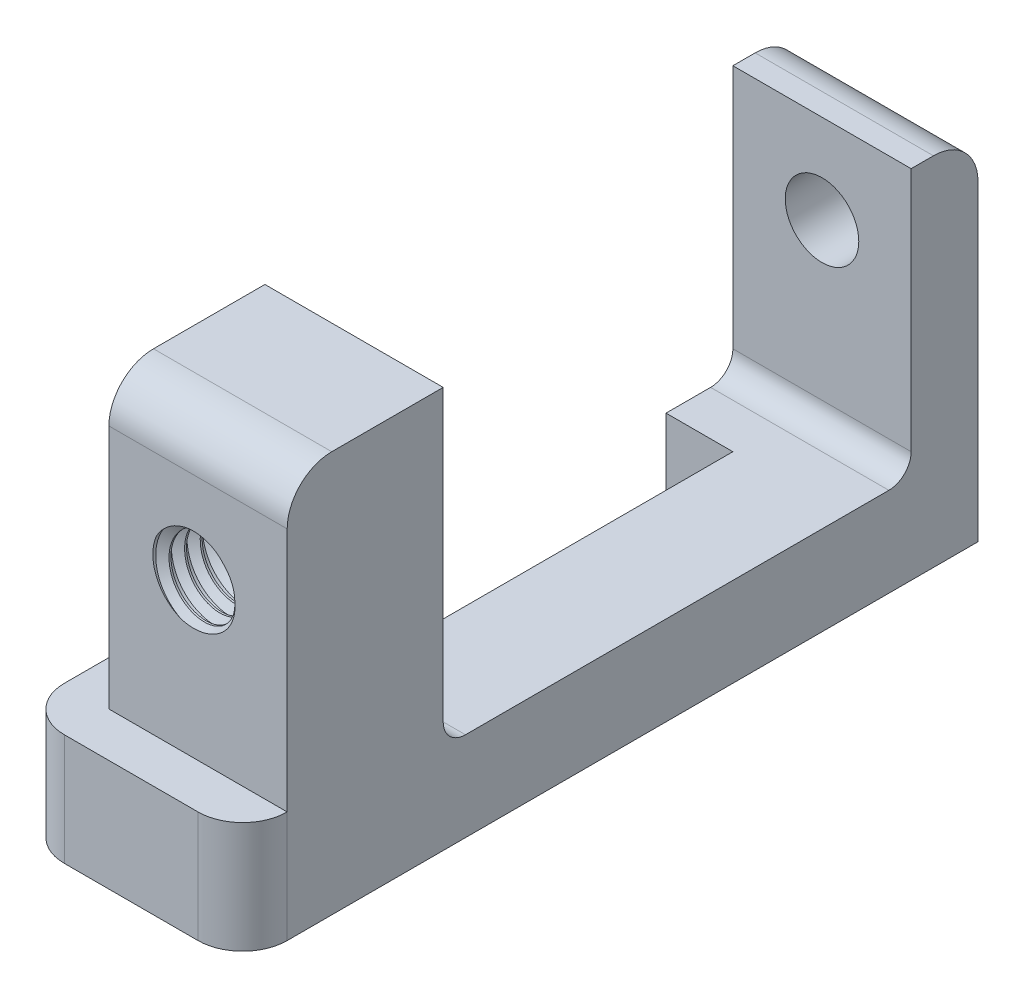
from build123d import *

# Parameters (mm, degrees)
BOSS_EXTRUDE1_DEPTH             = 8
CUT_EXTRUDE2_DEPTH              = 21
BOSS_EXTRUDE2_DEPTH             = 3
BOSS_EXTRUDE5_DEPTH             = 5
SKETCH6_R                       = 1.65
CUT_EXTRUDE3_DEPTH              = 38.215588132
FILLET1_R                       = 2
THREAD1_PITCH                   = 0.7
THREAD3_PITCH                   = 0.5
FILLET2_R                       = 1
TAP_DRILL_FOR_M3X0_5_TAP1_D     = 2.5
TAP_DRILL_FOR_M3X0_5_TAP1_DEPTH = 3
TAP_DRILL_FOR_M3X0_5_TAP1_TIP   = 0.751075774
THREAD4_PITCH                   = 0.5


# Read off the part's stored shape, not the designer's step: Tap Drill for M3x0.5 Tap
with BuildPart() as part:
    # Sketch1 → Boss-Extrude1 (new body)
    with BuildSketch(Plane(origin=(0, 0, 0), x_dir=(0, 0, -1), z_dir=(1, 0, 0))):
        Polygon((0, 0), (0, 16), (-3, 16), (-3, 4), (-24, 4), (-24, 18), (-31, 18), (-31, 0), align=None)
    extrude(amount=-BOSS_EXTRUDE1_DEPTH)

    # Sketch5 → Cut-Extrude2 (cut)
    with BuildSketch(Plane.XY.offset(3)):
        Polygon((-8, 0), (-3, 0), (-5, 4), (-8, 4), align=None)
    extrude(amount=CUT_EXTRUDE2_DEPTH, mode=Mode.SUBTRACT)

    # Sketch8 → Boss-Extrude2 (add)
    with BuildSketch(Plane.XY.offset(3)):
        Polygon((-8, 4), (-5, 4), (-3, 0), (-8, 0), align=None)
    extrude(amount=BOSS_EXTRUDE2_DEPTH)

    # Sketch11 → Boss-Extrude5 (add)
    with BuildSketch(Plane.XZ):
        with BuildLine():
            Line((-10, 26), (-10, 33))
            Line((-10, 33), (-2, 33))
            ThreePointArc((-2, 33), (-0.585786438, 32.414213562), (0, 31))
            Line((0, 31), (-8, 31))
            Line((-8, 31), (-8, 24))
            ThreePointArc((-8, 24), (-9.414213562, 24.585786438), (-10, 26))
        make_face()
    extrude(amount=-BOSS_EXTRUDE5_DEPTH)

    # Sketch6 → Cut-Extrude3 (cut, through all)
    with BuildSketch(Plane.XY.offset(31)):
        with Locations((-4, 12)):
            Circle(SKETCH6_R)
    extrude(amount=-CUT_EXTRUDE3_DEPTH, mode=Mode.SUBTRACT)

    # Fillet1
    fillet1_edges = [part.edges().sort_by_distance(p)[0] for p in [
        (-4, 18, 31),
        (-4, 16, 0),
        (-10, 2.5, 33),
    ]]
    fillet(fillet1_edges, radius=FILLET1_R)

    # Tap Drill for M3x0.5 Tap outline → Tap Drill for M3x0.5 Tap (revolve, cut)
    with BuildSketch(Plane(origin=(-4.1, 0, 3), x_dir=(1, 0, 0), z_dir=(0, 0, 1))):
        Polygon((1.25, 3), (0, 3.751075774), (0, 0), (1.25, 0), align=None)
    revolve(axis=Axis((-4.1, 0, 3), (0, 1, 0)), mode=Mode.SUBTRACT)

    # Thread1: the profile of Thread Profile1 profile screwed along a right-hand helix of 10 turns, 6 arcs to a turn; built about Z, then put on its axis
    thread1_z = Axis((0, 0, 0), (0, 0, 1))
    thread1_corners = [(1.6497, 0, 0.612673207), (1.6497, 0, -0.000173205), (2.028886116, 0, 0.218750001), (2.028886116, 0, 0.393750001)]
    with BuildLine(mode=Mode.PRIVATE) as thread1_profile:
        Line(thread1_corners[0], thread1_corners[1])
        Line(thread1_corners[1], thread1_corners[2])
        Line(thread1_corners[2], thread1_corners[3])
        Line(thread1_corners[3], thread1_corners[0])
    thread1_cap = Face(thread1_profile.wire())
    thread1_turn_angles = [0, 30, 60, 90, 120, 150, 180, 210, 240, 270, 300, 330, 360]
    thread1_turn_weights = [1, 0.8660254037844387, 1, 0.8660254037844387, 1, 0.8660254037844387, 1, 0.8660254037844387, 1, 0.8660254037844387, 1, 0.8660254037844387, 1]
    thread1_turn_rails = [Edge.make_bspline([Vector(p[0], p[1], 0).rotate(thread1_z, thread1_turn_angles[k]) / thread1_turn_weights[k] + Vector(0, 0, p[2] + THREAD1_PITCH * thread1_turn_angles[k] / 360) for k in range(13)], [0, 0, 0, 1, 1, 2, 2, 3, 3, 4, 4, 5, 5, 6, 6, 6], 2, thread1_turn_weights) for p in thread1_corners]
    thread1_turn_sides = [Face.make_surface_from_curves(thread1_turn_rails[p[0]], thread1_turn_rails[p[1]]) for p in [(0, 1), (1, 2), (2, 3), (3, 0)]]
    thread1 = Plane(origin=(-4, 12, 24), x_dir=(1, 0, 0), z_dir=(0, 0, 1)) * Solid(Shell([*[p.moved(Location((0, 0, THREAD1_PITCH * i))) for i in range(10) for p in thread1_turn_sides], thread1_cap, thread1_cap.rotate(thread1_z, 3600).moved(Location((0, 0, THREAD1_PITCH * 3600 / 360)))]))
    add(thread1, mode=Mode.SUBTRACT)

    # Thread3: the profile of Thread Profile3 profile screwed along a right-hand helix of 6 turns, 6 arcs to a turn; built about Z, then put on its axis
    thread3_z = Axis((0, 0, 0), (0, 0, 1))
    thread3_corners = [(1.2497, 0, -0.000173205), (1.520632938, 0, 0.156249999), (1.520632938, 0, 0.218749999), (1.2497, 0, 0.375173204)]
    with BuildLine(mode=Mode.PRIVATE) as thread3_profile:
        Line(thread3_corners[0], thread3_corners[1])
        Line(thread3_corners[1], thread3_corners[2])
        Line(thread3_corners[2], thread3_corners[3])
        Line(thread3_corners[3], thread3_corners[0])
    thread3_cap = Face(thread3_profile.wire())
    thread3_turn_angles = [0, 30, 60, 90, 120, 150, 180, 210, 240, 270, 300, 330, 360]
    thread3_turn_weights = [1, 0.8660254037844387, 1, 0.8660254037844387, 1, 0.8660254037844387, 1, 0.8660254037844387, 1, 0.8660254037844387, 1, 0.8660254037844387, 1]
    thread3_turn_rails = [Edge.make_bspline([Vector(p[0], p[1], 0).rotate(thread3_z, thread3_turn_angles[k]) / thread3_turn_weights[k] + Vector(0, 0, p[2] + THREAD3_PITCH * thread3_turn_angles[k] / 360) for k in range(13)], [0, 0, 0, 1, 1, 2, 2, 3, 3, 4, 4, 5, 5, 6, 6, 6], 2, thread3_turn_weights) for p in thread3_corners]
    thread3_turn_sides = [Face.make_surface_from_curves(thread3_turn_rails[p[0]], thread3_turn_rails[p[1]]) for p in [(0, 1), (1, 2), (2, 3), (3, 0)]]
    thread3 = Plane(origin=(-4.1, 0, 3), x_dir=(1, 0, 0), z_dir=(0, 1, 0)) * Solid(Shell([*[p.moved(Location((0, 0, THREAD3_PITCH * i))) for i in range(6) for p in thread3_turn_sides], thread3_cap, thread3_cap.rotate(thread3_z, 2160).moved(Location((0, 0, THREAD3_PITCH * 2160 / 360)))]))
    add(thread3, mode=Mode.SUBTRACT)

    # Fillet2
    fillet2_edges = [part.edges().sort_by_distance(p)[0] for p in [
        (-4, 4, 3),
        (-2.5, 4, 24),
    ]]
    fillet(fillet2_edges, radius=FILLET2_R)

    # Tap Drill for M3x0.5 Tap1
    with Locations(Plane(origin=(-5.72, 0, 29), x_dir=(0, 0, -1), z_dir=(0, -1, 0))):
        with Locations((0, 0)):
            Hole(TAP_DRILL_FOR_M3X0_5_TAP1_D / 2, depth=TAP_DRILL_FOR_M3X0_5_TAP1_DEPTH)
            with Locations((0, 0, -(TAP_DRILL_FOR_M3X0_5_TAP1_DEPTH + TAP_DRILL_FOR_M3X0_5_TAP1_TIP / 2))):  # 118° drill point
                Cone(0, TAP_DRILL_FOR_M3X0_5_TAP1_D / 2, TAP_DRILL_FOR_M3X0_5_TAP1_TIP, mode=Mode.SUBTRACT)

    # Thread4: the profile of Thread Profile4 profile screwed along a right-hand helix of 6 turns, 6 arcs to a turn; built about Z, then put on its axis
    thread4_z = Axis((0, 0, 0), (0, 0, 1))
    thread4_corners = [(1.2497, 0, -0.000173205), (1.520632937, 0, 0.156249999), (1.520632937, 0, 0.218749999), (1.2497, 0, 0.375173204)]
    with BuildLine(mode=Mode.PRIVATE) as thread4_profile:
        Line(thread4_corners[0], thread4_corners[1])
        Line(thread4_corners[1], thread4_corners[2])
        Line(thread4_corners[2], thread4_corners[3])
        Line(thread4_corners[3], thread4_corners[0])
    thread4_cap = Face(thread4_profile.wire())
    thread4_turn_angles = [0, 30, 60, 90, 120, 150, 180, 210, 240, 270, 300, 330, 360]
    thread4_turn_weights = [1, 0.8660254037844387, 1, 0.8660254037844387, 1, 0.8660254037844387, 1, 0.8660254037844387, 1, 0.8660254037844387, 1, 0.8660254037844387, 1]
    thread4_turn_rails = [Edge.make_bspline([Vector(p[0], p[1], 0).rotate(thread4_z, thread4_turn_angles[k]) / thread4_turn_weights[k] + Vector(0, 0, p[2] + THREAD4_PITCH * thread4_turn_angles[k] / 360) for k in range(13)], [0, 0, 0, 1, 1, 2, 2, 3, 3, 4, 4, 5, 5, 6, 6, 6], 2, thread4_turn_weights) for p in thread4_corners]
    thread4_turn_sides = [Face.make_surface_from_curves(thread4_turn_rails[p[0]], thread4_turn_rails[p[1]]) for p in [(0, 1), (1, 2), (2, 3), (3, 0)]]
    thread4 = Plane(origin=(-5.72, 0, 29), x_dir=(1, 0, 0), z_dir=(0, 1, 0)) * Solid(Shell([*[p.moved(Location((0, 0, THREAD4_PITCH * i))) for i in range(6) for p in thread4_turn_sides], thread4_cap, thread4_cap.rotate(thread4_z, 2160).moved(Location((0, 0, THREAD4_PITCH * 2160 / 360)))]))
    add(thread4, mode=Mode.SUBTRACT)


solid = part.part
